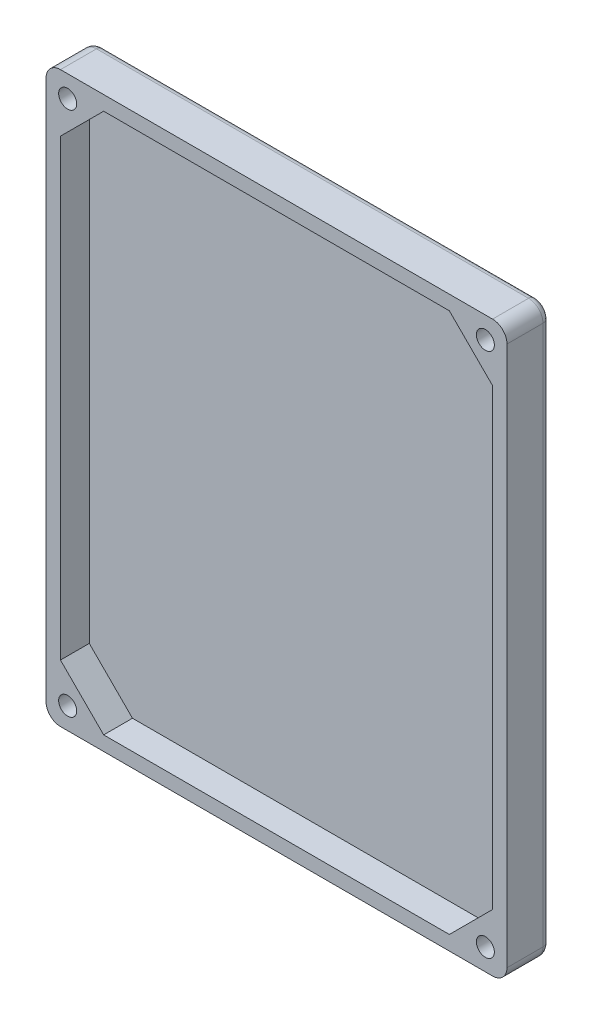
from build123d import *

# Parameters (mm, degrees)
SKETCH1_W           = 64
SKETCH1_H           = 79
BOSS_EXTRUDE1_DEPTH = 2
SKETCH2_W           = 64
SKETCH2_H           = 79
BOSS_EXTRUDE6_DEPTH = 4
FILLET1_R           = 2
FILLET2_R           = 2
FILLET3_R           = 2
FILLET4_R           = 2
SKETCH4_R           = 2
CUT_EXTRUDE1_DEPTH  = 2
SKETCH6_R           = 1.25
CUT_EXTRUDE2_DEPTH  = 4
FILLET5_R           = 1


with BuildPart() as part:
    # Sketch1 → Boss-Extrude1 (new body)
    with BuildSketch(Plane.XY):
        Rectangle(SKETCH1_W, SKETCH1_H)
    extrude(amount=BOSS_EXTRUDE1_DEPTH)

    # Sketch2 → Boss-Extrude6 (add)
    with BuildSketch(Plane.XY.offset(2)):
        Rectangle(SKETCH2_W, SKETCH2_H)
        Polygon((-30, 31.5), (-24, 37.5), (24, 37.5), (30, 31.5), (30, -31.5), (24, -37.5), (-24, -37.5), (-30, -31.5), align=None, mode=Mode.SUBTRACT)
    extrude(amount=BOSS_EXTRUDE6_DEPTH)

    # Fillet1
    fillet1_edges = [part.edges().sort_by_distance(p)[0] for p in [
        (-32, -39.5, 3),
    ]]
    fillet(fillet1_edges, radius=FILLET1_R)

    # Fillet2
    fillet2_edges = [part.edges().sort_by_distance(p)[0] for p in [
        (32, -39.5, 3),
    ]]
    fillet(fillet2_edges, radius=FILLET2_R)

    # Fillet3
    fillet3_edges = [part.edges().sort_by_distance(p)[0] for p in [
        (32, 39.5, 3),
    ]]
    fillet(fillet3_edges, radius=FILLET3_R)

    # Fillet4
    fillet4_edges = [part.edges().sort_by_distance(p)[0] for p in [
        (-32, 39.5, 3),
    ]]
    fillet(fillet4_edges, radius=FILLET4_R)

    # Sketch4 → Cut-Extrude1 (cut)
    with BuildSketch(Plane(origin=(0, 0, 0), x_dir=(-1, 0, 0), z_dir=(0, 0, -1))):
        with Locations((29, 36.5)):
            Circle(SKETCH4_R)
        with Locations((29, -36.5)):
            Circle(SKETCH4_R)
        with Locations((-29, -36.5)):
            Circle(SKETCH4_R)
        with Locations((-29, 36.5)):
            Circle(SKETCH4_R)
    extrude(amount=-CUT_EXTRUDE1_DEPTH, mode=Mode.SUBTRACT)

    # Sketch6 → Cut-Extrude2 (cut)
    with BuildSketch(Plane(origin=(0, 0, 2), x_dir=(-1, 0, 0), z_dir=(0, 0, -1))):
        with Locations((29, 36.5)):
            Circle(SKETCH6_R)
        with Locations((29, -36.5)):
            Circle(SKETCH6_R)
        with Locations((-29, -36.5)):
            Circle(SKETCH6_R)
        with Locations((-29, 36.5)):
            Circle(SKETCH6_R)
    extrude(amount=-CUT_EXTRUDE2_DEPTH, mode=Mode.SUBTRACT)

    # Fillet5
    fillet5_edges = [part.edges().sort_by_distance(p)[0] for p in [
        (0, -39.5, 0),
        (-31.414213562, -38.914213562, 0),
        (32, 0, 0),
        (31.414213562, -38.914213562, 0),
        (0, 39.5, 0),
        (31.414213562, 38.914213562, 0),
        (-32, 0, 0),
        (-31.414213562, 38.914213562, 0),
    ]]
    fillet(fillet5_edges, radius=FILLET5_R - 0.0001)  # a hair under: the kernel refuses the full size


solid = part.part
